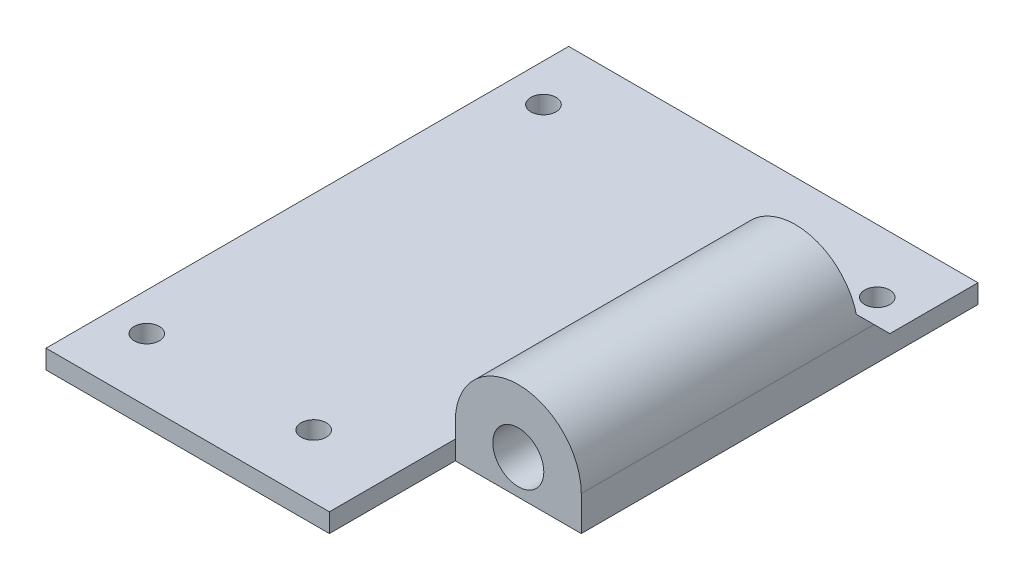
from build123d import *

# Parameters (mm, degrees)
BOSS_EXTRUDE1_DEPTH = 3
SKETCH3_R           = 2
CUT_EXTRUDE1_DEPTH  = 5
BOSS_EXTRUDE4_DEPTH = 44
SKETCH6_R           = 4.05
CUT_EXTRUDE3_DEPTH  = 40
CHAMFER2_SIZE       = 5


with BuildPart() as part:
    # Sketch1 → Boss-Extrude1 (new body)
    with BuildSketch(Plane(origin=(0, 0, 0), x_dir=(1, 0, 0), z_dir=(0, 1, 0))):
        Polygon((45, -83), (45, -63), (65, -63), (65, 0), (0, 0), (0, -83), align=None)
    extrude(amount=BOSS_EXTRUDE1_DEPTH)

    # Sketch3 → Cut-Extrude1 (cut)
    with BuildSketch(Plane(origin=(0, 3, 0), x_dir=(1, 0, 0), z_dir=(0, 1, 0))):
        with Locations((6, -10)):
            Circle(SKETCH3_R)
        with Locations((59, -10)):
            Circle(SKETCH3_R)
        with Locations((6, -73)):
            Circle(SKETCH3_R)
        with Locations((32.5, -73)):
            Circle(SKETCH3_R)
    extrude(amount=-CUT_EXTRUDE1_DEPTH, mode=Mode.SUBTRACT)

    # Sketch4 → Boss-Extrude4 (add)
    with BuildSketch(Plane.XY.offset(63)):
        with BuildLine():
            Line((45, 5.5), (45, 3))
            Line((45, 3), (65, 3))
            Line((65, 3), (65, 5.5))
            ThreePointArc((65, 5.5), (55, 15.5), (45, 5.5))
        make_face()
    extrude(amount=-BOSS_EXTRUDE4_DEPTH)

    # Sketch6 → Cut-Extrude3 (cut)
    with BuildSketch(Plane.XY.offset(63)):
        with Locations((55, 5.5)):
            Circle(SKETCH6_R)
    extrude(amount=-CUT_EXTRUDE3_DEPTH, mode=Mode.SUBTRACT)

    # Chamfer2
    chamfer2_edges = [part.edges().sort_by_distance(p)[0] for p in [
        (55, 3, 19),
    ]]
    chamfer(chamfer2_edges, length=CHAMFER2_SIZE)


solid = part.part
